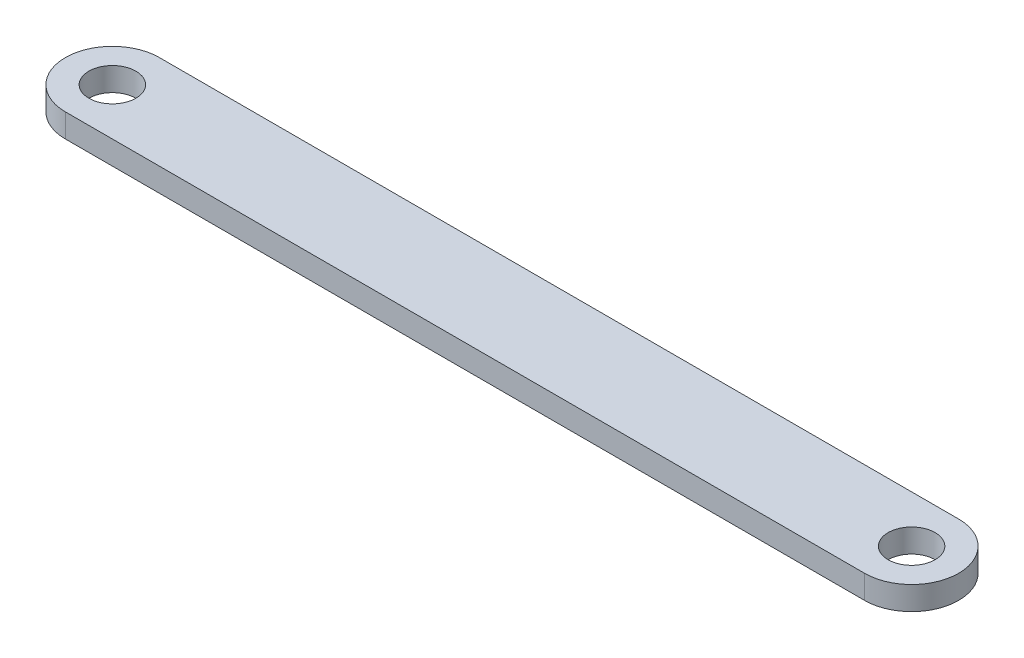
from build123d import *

# Parameters (mm, degrees)
SKETCH1_R           = 5
BOSS_EXTRUDE1_DEPTH = 5


with BuildPart() as part:
    # Sketch1 → Boss-Extrude1 (new body)
    with BuildSketch(Plane(origin=(0, 0, 0), x_dir=(1, 0, 0), z_dir=(0, 1, 0))):
        with BuildLine():
            Line((-85, 10), (85, 10))
            ThreePointArc((85, 10), (95, 0), (85, -10))
            Line((85, -10), (-85, -10))
            ThreePointArc((-85, -10), (-95, 0), (-85, 10))
        make_face()
        with Locations((-85, 0)):
            Circle(SKETCH1_R, mode=Mode.SUBTRACT)
        with Locations((85, 0)):
            Circle(SKETCH1_R, mode=Mode.SUBTRACT)
    extrude(amount=BOSS_EXTRUDE1_DEPTH)


solid = part.part
